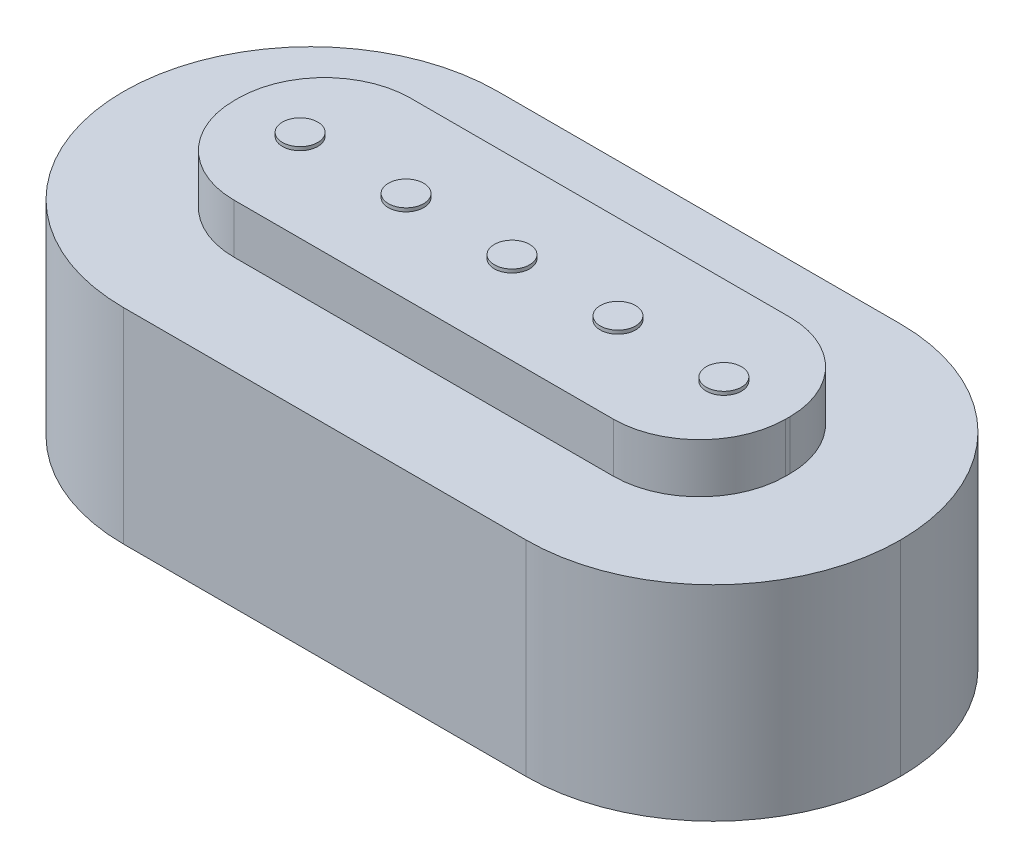
from build123d import *

# Parameters (mm, degrees)
SKETCH1_W                = 11
SKETCH1_H                = 5.3
BOSS_EXTRUDE1_DEPTH      = 2.9
SKETCH2_W                = 7.81
SKETCH2_H                = 2.5
BOSS_EXTRUDE2_DEPTH      = 0.7
BOSS_EXTRUDE3_DEPTH      = 1.6
BOSS_EXTRUDE3_DEPTH_BACK = 3.65
SKETCH3_R                = 0.25
CHAMFER1_SIZE            = 0.08
FILLET1_R                = 2.65
FILLET2_R                = 1.22


with BuildPart() as part:
    # Sketch1 → Boss-Extrude1 (new body)
    with BuildSketch(Plane(origin=(0, 0, 0), x_dir=(1, 0, 0), z_dir=(0, 1, 0))):
        with Locations((1.596774194, -1.130364656)):
            Rectangle(SKETCH1_W, SKETCH1_H)
    extrude(amount=BOSS_EXTRUDE1_DEPTH)

    # Sketch2 → Boss-Extrude2 (add)
    with BuildSketch(Plane(origin=(0, 2.9, 0), x_dir=(1, 0, 0), z_dir=(0, 1, 0))):
        with Locations((1.596774194, -1.130364656)):
            Rectangle(SKETCH2_W, SKETCH2_H)
    extrude(amount=BOSS_EXTRUDE2_DEPTH)

    # Sketch3 → Boss-Extrude3 (add, two sides: drawn at the far end of the back side and taken through both)
    with BuildSketch(Plane.XZ.offset(-BOSS_EXTRUDE3_DEPTH_BACK)):
        with Locations(Location((1.596774194, 1.130364656, 0), (0, 0, 90))):
            Circle(SKETCH3_R)
        with Locations(Location((3.096774194, 1.130364656, 0), (0, 0, 90))):
            Circle(SKETCH3_R)
        with Locations(Location((4.596774194, 1.130364656, 0), (0, 0, 90))):
            Circle(SKETCH3_R)
        with Locations(Location((0.096774194, 1.130364656, 0), (0, 0, 90))):
            Circle(SKETCH3_R)
        with Locations(Location((-1.403225806, 1.130364656, 0), (0, 0, 90))):
            Circle(SKETCH3_R)
    extrude(amount=BOSS_EXTRUDE3_DEPTH + BOSS_EXTRUDE3_DEPTH_BACK)

    # Chamfer1
    chamfer1_edges = [part.edges().sort_by_distance(p)[0] for p in [
        (1.596774194, -1.6, 0.880364656),
        (3.096774194, -1.6, 0.880364656),
        (4.596774194, -1.6, 0.880364656),
        (0.096774194, -1.6, 0.880364656),
        (-1.403225806, -1.6, 0.880364656),
    ]]
    chamfer(chamfer1_edges, length=CHAMFER1_SIZE)

    # Fillet1
    fillet1_edges = [part.edges().sort_by_distance(p)[0] for p in [
        (-3.903225806, 1.45, -1.519635344),
        (-3.903225806, 1.45, 3.780364656),
        (7.096774194, 1.45, 3.780364656),
        (7.096774194, 1.45, -1.519635344),
    ]]
    fillet(fillet1_edges, radius=FILLET1_R - 0.0001)  # a hair under: the kernel refuses the full size

    # Fillet2
    fillet2_edges = [part.edges().sort_by_distance(p)[0] for p in [
        (-2.308225806, 3.25, -0.119635344),
        (-2.308225806, 3.25, 2.380364656),
        (5.501774194, 3.25, 2.380364656),
        (5.501774194, 3.25, -0.119635344),
    ]]
    fillet(fillet2_edges, radius=FILLET2_R)


solid = part.part
